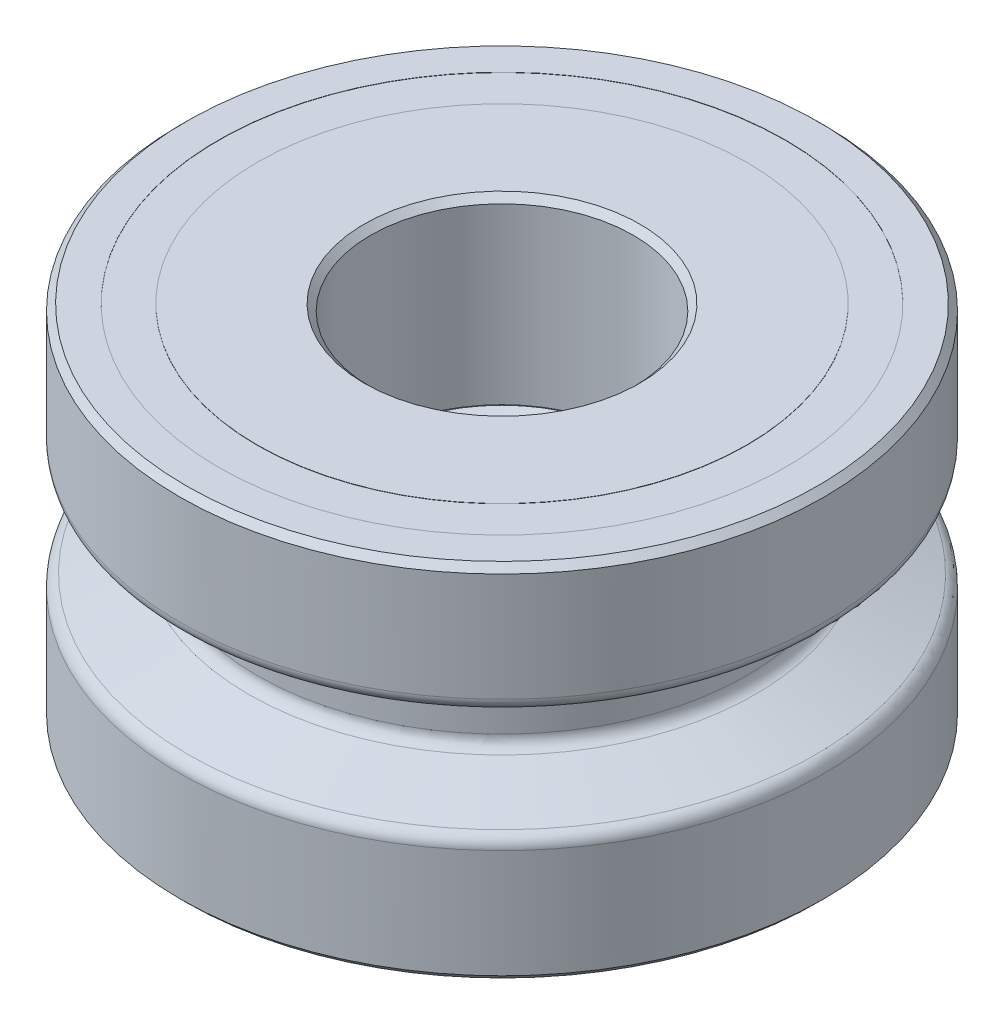
from build123d import *

# Parameters (mm, degrees)
SKETCH1_R           = 12.5
BOSS_EXTRUDE1_DEPTH = 7
CUT_EXTRUDE1_REACH  = 24.55
SKETCH2_R           = 4
SKETCH11_R          = 5.1
CUT_EXTRUDE5_DEPTH  = 4
CUT_EXTRUDE6_START  = -7
SKETCH12_R          = 5.1
CUT_EXTRUDE6_DEPTH  = 7
SKETCH7_R           = 11
SKETCH7_R_2         = 9.5
CUT_EXTRUDE4_DEPTH  = 0.01
CHAMFER2_SIZE       = 0.5
CHAMFER2_SIZE2      = 1.07225346
FILLET4_R           = 0.5
CHAMFER1_SIZE       = 0.25


with BuildPart() as part:
    # Sketch1 → Boss-Extrude1 (new, symmetric)
    with BuildSketch(Plane(origin=(0, 0, 0), x_dir=(1, 0, 0), z_dir=(0, 1, 0))):
        Circle(SKETCH1_R)
    extrude(amount=BOSS_EXTRUDE1_DEPTH, both=True)

    # Sketch2 → Cut-Extrude1 (cut, up to next)
    with BuildSketch(Plane.XZ.offset(7), mode=Mode.PRIVATE) as cut_extrude1_sk1:
        Circle(SKETCH2_R)
    cut_extrude1_tool1 = extrude(cut_extrude1_sk1.sketch, amount=-CUT_EXTRUDE1_REACH, mode=Mode.PRIVATE) & part.part
    add(cut_extrude1_tool1.solids().sort_by_distance((0, -7, 0))[0], mode=Mode.SUBTRACT)

    # Sketch11 → Cut-Extrude5 (cut)
    with BuildSketch(Plane.XZ.offset(7)):
        Circle(SKETCH11_R)
    extrude(amount=-CUT_EXTRUDE5_DEPTH, mode=Mode.SUBTRACT)

    # Sketch12 → Cut-Extrude6 (cut)
    with BuildSketch(Plane(origin=(0, 7, 0), x_dir=(1, 0, 0), z_dir=(0, 1, 0)).offset(CUT_EXTRUDE6_START)):
        Circle(SKETCH12_R)
    extrude(amount=CUT_EXTRUDE6_DEPTH, mode=Mode.SUBTRACT)

    # Sketch7 → Cut-Extrude4 (cut)
    with BuildSketch(Plane(origin=(0, 7, 0), x_dir=(1, 0, 0), z_dir=(0, 1, 0))):
        Circle(SKETCH7_R)
        Circle(SKETCH7_R_2, mode=Mode.SUBTRACT)
    extrude(amount=-CUT_EXTRUDE4_DEPTH, mode=Mode.SUBTRACT)

    # Sketch10 → Cut-Revolve1 (revolve, cut)
    with BuildSketch(Plane.XY):
        Polygon((12.5, 2.191910703), (9.5, 1.1), (9.5, -1.1), (12.5, -2.191910703), align=None)
    revolve(axis=Axis((0, 7, 0), (0, -1, 0)), mode=Mode.SUBTRACT)

    # Chamfer2
    chamfer2_edges = [part.edges().sort_by_distance(p)[0] for p in [
        (-4, 0, 0),
    ]]
    chamfer2_side = [part.faces().sort_by_distance(p)[0] for p in [
        (-4, -1.5, 0),
    ]]
    chamfer(chamfer2_edges, length=CHAMFER2_SIZE, length2=CHAMFER2_SIZE2, reference=chamfer2_side[0])

    # Fillet4
    fillet4_edges = [part.edges().sort_by_distance(p)[0] for p in [
        (-9.5, -1.1, 0),
        (-9.5, 1.1, 0),
        (-12.5, 2.191910703, 0),
        (-12.5, -2.191910703, 0),
    ]]
    fillet(fillet4_edges, radius=FILLET4_R)

    # Chamfer1
    chamfer1_edges = [part.edges().sort_by_distance(p)[0] for p in [
        (-12.5, -7, 0),
        (-12.5, 7, 0),
        (-5.1, -7, 0),
        (-5.1, 7, 0),
        (-4, -3, 0),
    ]]
    chamfer(chamfer1_edges, length=CHAMFER1_SIZE)


solid = part.part
